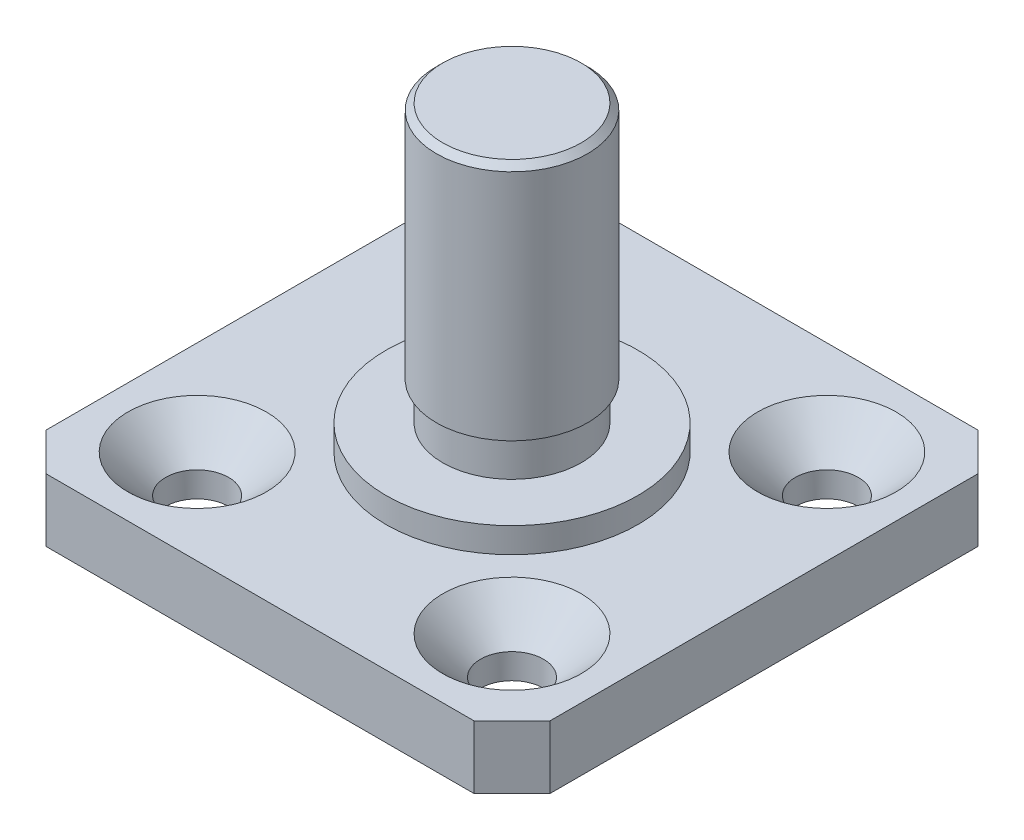
from build123d import *

# Parameters (mm, degrees)
SKETCH_1_W          = 40
SKETCH_1_H          = 40
EXTRUDE_1_DEPTH     = 5
CHAMFER_1_SIZE      = 3
SKETCH_2_R          = 10
EXTRUDE_2_DEPTH     = 2
SKETCH_3_R          = 6
EXTRUDE_3_DEPTH     = 22
SKETCH_4_R          = 6
SKETCH_4_R_2        = 5.5
CUT_EXTRUDE_1_DEPTH = 3
SKETCH_5_R          = 2.5
CUT_EXTRUDE_2_DEPTH = 38.094473982
CHAMFER_2_SIZE      = 3
CHAMFER_3_SIZE      = 0.5


with BuildPart() as part:
    # Эскиз1 → Бобышка-Вытянуть1 (new body)
    with BuildSketch(Plane(origin=(0, 0, 0), x_dir=(1, 0, 0), z_dir=(0, 1, 0))):
        Rectangle(SKETCH_1_W, SKETCH_1_H)
    extrude(amount=EXTRUDE_1_DEPTH)

    # Фаска1
    chamfer_1_edges = [part.edges().sort_by_distance(p)[0] for p in [
        (-20, 2.5, -20),
        (20, 2.5, -20),
        (-20, 2.5, 20),
        (20, 2.5, 20),
    ]]
    chamfer(chamfer_1_edges, length=CHAMFER_1_SIZE)

    # Эскиз2 → Бобышка-Вытянуть2 (add)
    with BuildSketch(Plane(origin=(0, 5, 0), x_dir=(1, 0, 0), z_dir=(0, 1, 0))):
        Circle(SKETCH_2_R)
    extrude(amount=EXTRUDE_2_DEPTH)

    # Эскиз3 → Бобышка-Вытянуть3 (add)
    with BuildSketch(Plane(origin=(0, 7, 0), x_dir=(1, 0, 0), z_dir=(0, 1, 0))):
        Circle(SKETCH_3_R)
    extrude(amount=EXTRUDE_3_DEPTH)

    # Эскиз4 → Вырез-Вытянуть1 (cut)
    with BuildSketch(Plane(origin=(0, 7, 0), x_dir=(1, 0, 0), z_dir=(0, 1, 0))):
        Circle(SKETCH_4_R)
        Circle(SKETCH_4_R_2, mode=Mode.SUBTRACT)
    extrude(amount=CUT_EXTRUDE_1_DEPTH, mode=Mode.SUBTRACT)

    # Эскиз5 → Вырез-Вытянуть2 (cut, through all)
    with BuildSketch(Plane(origin=(0, 5, 0), x_dir=(1, 0, 0), z_dir=(0, 1, 0))):
        with Locations((-12.5, 12.5)):
            Circle(SKETCH_5_R)
        with Locations((12.5, 12.5)):
            Circle(SKETCH_5_R)
        with Locations((12.5, -12.5)):
            Circle(SKETCH_5_R)
        with Locations((-12.5, -12.5)):
            Circle(SKETCH_5_R)
    extrude(amount=-CUT_EXTRUDE_2_DEPTH, mode=Mode.SUBTRACT)

    # Фаска2
    chamfer_2_edges = [part.edges().sort_by_distance(p)[0] for p in [
        (-15, 5, 12.5),
        (10, 5, 12.5),
        (10, 5, -12.5),
        (-15, 5, -12.5),
    ]]
    chamfer(chamfer_2_edges, length=CHAMFER_2_SIZE)

    # Фаска3
    chamfer_3_edges = [part.edges().sort_by_distance(p)[0] for p in [
        (-6, 29, 0),
    ]]
    chamfer(chamfer_3_edges, length=CHAMFER_3_SIZE)


solid = part.part
